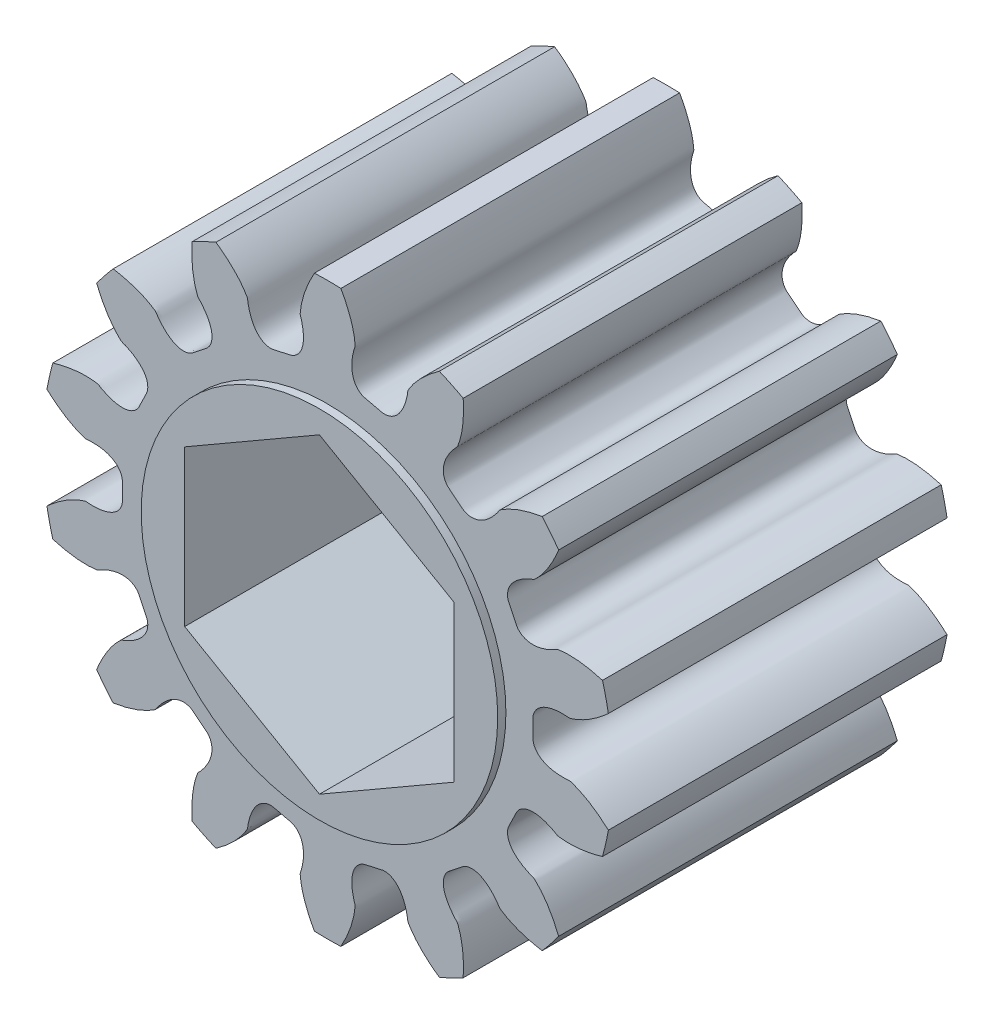
from build123d import *

# Parameters (mm, degrees)
BOSS_EXTRUDE1_DEPTH = 12.065
SKETCH2_R           = 6.35
BOSS_EXTRUDE2_DEPTH = 0.2921
BOSS_EXTRUDE3_START = 0.2921
SKETCH3_R           = 6.35
BOSS_EXTRUDE3_DEPTH = 0.2921
CUT_EXTRUDE1_DEPTH  = 20.058275239


with BuildPart() as part:
    # Sketch1 → Boss-Extrude1 (new body)
    with BuildSketch(Plane.XY.offset(6.0325)):
        with BuildLine():
            ThreePointArc((8.228776346, 5.959265042), (7.943407862, 6.334656387), (7.640928824, 6.69640252))
            add(Edge.make_bspline(
                [(4.82824311, 8.939444528), (4.833892588, 8.852687386), (4.83956114, 8.714236491), (4.839397518, 8.527056628), (4.834597301, 8.381215605), (4.825704165, 8.244427954), (4.813292608, 8.116797302), (4.797939964, 7.998399272), (4.780222678, 7.889283272), (4.760723014, 7.789466905), (4.740002099, 7.698954413), (4.718682579, 7.617677092), (4.697178715, 7.545684876), (4.676542333, 7.482543191), (4.650701206, 7.415927439), (4.621669261, 7.324730091), (4.540040809, 7.261231409), (4.481952223, 7.188233595), (4.43551344, 7.130936279), (4.39285588, 7.073433212), (4.35314075, 7.016307214), (4.316544651, 6.959436941), (4.282987183, 6.902864935), (4.252459951, 6.846571912), (4.224945594, 6.790531236), (4.200443436, 6.734690952), (4.178969629, 6.678974044), (4.160566483, 6.623273893), (4.145313008, 6.567451505), (4.133339922, 6.5113341), (4.12484958, 6.454717507), (4.120141721, 6.397375872), (4.119644468, 6.339084418), (4.123947256, 6.279663842), (4.133825193, 6.219056118), (4.150237388, 6.157442121), (4.174255479, 6.095387744), (4.206926479, 6.034019633), (4.248882322, 5.975011401), (4.295645816, 5.925851012), (4.399067692, 5.839116758), (4.564695196, 5.723946729), (4.713833258, 5.588099595), (4.821406436, 5.506570908), (4.879740128, 5.471919088), (4.946604954, 5.444145733), (5.01370442, 5.425949552), (5.079547492, 5.416342044), (5.143268754, 5.41405174), (5.204554963, 5.417907952), (5.263443202, 5.426935365), (5.320162519, 5.44039122), (5.375018882, 5.457740758), (5.4283267, 5.478616606), (5.480372862, 5.502776799), (5.531401448, 5.530069487), (5.581609996, 5.560405678), (5.631151593, 5.593739269), (5.680139601, 5.63005274), (5.7286527, 5.669347478), (5.776741391, 5.711635705), (5.82442778, 5.756940272), (5.871728798, 5.805273657), (5.918585081, 5.856704777), (5.965154226, 5.911088458), (6.010681377, 5.969112777), (6.068923056, 6.041988502), (6.112665655, 6.135700144), (6.195116279, 6.184297517), (6.254311643, 6.224314153), (6.311278208, 6.258483483), (6.376680368, 6.295467976), (6.451175858, 6.334338877), (6.534808176, 6.374681199), (6.627782855, 6.415903197), (6.730220622, 6.457456868), (6.842233881, 6.498770629), (6.963902735, 6.539271495), (7.095281925, 6.578379777), (7.23639826, 6.615512324), (7.418848724, 6.657323281), (7.555089737, 6.682605074), (7.640928824, 6.69640252)],
                knots=[0.010313213, 0.010313213, 0.010313213, 0.010313213, 0.046086444, 0.067310464, 0.087321683, 0.106120101, 0.123705718, 0.140078533, 0.155238548, 0.169185761, 0.181920174, 0.193441785, 0.203750595, 0.212846604, 0.220729812, 0.233281794, 0.251264484, 0.261666579, 0.271771633, 0.281588016, 0.291125391, 0.300394957, 0.309409753, 0.318185016, 0.32673863, 0.335091659, 0.343268986, 0.351300066, 0.359219801, 0.367069473, 0.374897695, 0.382761153, 0.390724829, 0.398861066, 0.407246569, 0.415956082, 0.425051594, 0.434566975, 0.44449066, 0.454752968, 0.462386324, 0.5, 0.537613676, 0.545247032, 0.55550934, 0.565433025, 0.574948406, 0.584043918, 0.592753431, 0.601138934, 0.609275171, 0.617238847, 0.625102305, 0.632930527, 0.640780199, 0.648699934, 0.656731014, 0.664908341, 0.67326137, 0.681814984, 0.690590247, 0.699605043, 0.708874609, 0.718411984, 0.728228367, 0.738333421, 0.748735516, 0.766718206, 0.779270188, 0.787153396, 0.796249405, 0.806558215, 0.818079826, 0.830814239, 0.844761452, 0.859921467, 0.876294282, 0.893879899, 0.912678317, 0.932689536, 0.953913556, 0.989686787, 0.989686787, 0.989686787, 0.989686787], degree=3))
            ThreePointArc((4.82824311, 8.939444528), (4.408258789, 9.153843698), (3.978778828, 9.348524966))
            add(Edge.make_bspline(
                [(0.471417111, 10.14905739), (0.514149629, 10.073343122), (0.579328409, 9.951062669), (0.66039529, 9.782348447), (0.719348491, 9.648867489), (0.770685991, 9.521767488), (0.814880429, 9.40139107), (0.852419155, 9.288056869), (0.883800089, 9.182059508), (0.909540197, 9.083667481), (0.930143197, 8.993128076), (0.946199881, 8.910649547), (0.958061821, 8.836456624), (0.966865234, 8.770614142), (0.972486674, 8.699383378), (0.985898842, 8.604620918), (0.939905194, 8.511993324), (0.919241751, 8.421020874), (0.902262226, 8.349248743), (0.888778739, 8.278931848), (0.877782684, 8.210231353), (0.869485825, 8.143114555), (0.863797265, 8.077584899), (0.860717807, 8.013621369), (0.860243365, 7.951192432), (0.862395875, 7.890250987), (0.867223304, 7.830734652), (0.874810032, 7.772565723), (0.885287552, 7.715653255), (0.898848604, 7.659898293), (0.91576409, 7.605204685), (0.936402058, 7.551498993), (0.961245763, 7.498764457), (0.990904063, 7.447095278), (1.026100482, 7.396775482), (1.06762067, 7.348384173), (1.116184607, 7.30289617), (1.172246787, 7.261780829), (1.235650407, 7.226820207), (1.299112753, 7.202818146), (1.429925226, 7.169546354), (1.629120853, 7.137644824), (1.822431467, 7.079959365), (1.954725523, 7.053178809), (2.022317225, 7.047268639), (2.094610758, 7.051257271), (2.162960315, 7.063976446), (2.226451415, 7.083888618), (2.284856014, 7.109472745), (2.338399833, 7.139538162), (2.387539455, 7.173222229), (2.432803517, 7.209955125), (2.47469971, 7.249387802), (2.513670703, 7.291325687), (2.55007996, 7.335675252), (2.584213274, 7.382405588), (2.616287232, 7.431522224), (2.646459766, 7.483050046), (2.674840612, 7.537022452), (2.701500055, 7.593474833), (2.726478295, 7.652440109), (2.749785332, 7.713948463), (2.771431007, 7.778018481), (2.791331932, 7.844686497), (2.809693087, 7.913890096), (2.825535825, 7.985921691), (2.846390172, 8.076850568), (2.845140934, 8.180261043), (2.89834077, 8.259819748), (2.934311383, 8.321557397), (2.970810967, 8.377059766), (3.013689307, 8.438758577), (3.063941972, 8.50610243), (3.12178821, 8.578736309), (3.187669946, 8.656216247), (3.261933723, 8.738100893), (3.344928813, 8.823924037), (3.436975996, 8.913204193), (3.538376109, 9.005442832), (3.649406325, 9.100126183), (3.795647418, 9.216958844), (3.90742697, 9.298849712), (3.978778828, 9.348524966)],
                knots=[0.010313213, 0.010313213, 0.010313213, 0.010313213, 0.046086444, 0.067310464, 0.087321683, 0.106120101, 0.123705718, 0.140078533, 0.155238548, 0.169185761, 0.181920174, 0.193441785, 0.203750595, 0.212846604, 0.220729812, 0.233281794, 0.251264484, 0.261666579, 0.271771633, 0.281588016, 0.291125391, 0.300394957, 0.309409753, 0.318185016, 0.32673863, 0.335091659, 0.343268986, 0.351300066, 0.359219801, 0.367069473, 0.374897695, 0.382761153, 0.390724829, 0.398861066, 0.407246569, 0.415956082, 0.425051594, 0.434566975, 0.44449066, 0.454752968, 0.462386324, 0.5, 0.537613676, 0.545247032, 0.55550934, 0.565433025, 0.574948406, 0.584043918, 0.592753431, 0.601138934, 0.609275171, 0.617238847, 0.625102305, 0.632930527, 0.640780199, 0.648699934, 0.656731014, 0.664908341, 0.67326137, 0.681814984, 0.690590247, 0.699605043, 0.708874609, 0.718411984, 0.728228367, 0.738333421, 0.748735516, 0.766718206, 0.779270188, 0.787153396, 0.796249405, 0.806558215, 0.818079826, 0.830814239, 0.844761452, 0.859921467, 0.876294282, 0.893879899, 0.912678317, 0.932689536, 0.953913556, 0.989686787, 0.989686787, 0.989686787, 0.989686787], degree=3))
            ThreePointArc((0.471417111, 10.14905739), (0, 10.16), (-0.471417111, 10.14905739))
            add(Edge.make_bspline(
                [(-3.978778828, 9.348524966), (-3.90742697, 9.298849712), (-3.795647418, 9.216958844), (-3.649406325, 9.100126183), (-3.538376109, 9.005442832), (-3.436975996, 8.913204193), (-3.344928813, 8.823924037), (-3.261933723, 8.738100893), (-3.187669946, 8.656216247), (-3.12178821, 8.578736309), (-3.063941972, 8.50610243), (-3.013689307, 8.438758577), (-2.970810967, 8.377059766), (-2.934311383, 8.321557397), (-2.89834077, 8.259819748), (-2.845140934, 8.180261043), (-2.846390172, 8.076850568), (-2.825535825, 7.985921691), (-2.809693087, 7.913890096), (-2.791331932, 7.844686497), (-2.771431007, 7.778018481), (-2.749785332, 7.713948463), (-2.726478295, 7.652440109), (-2.701500055, 7.593474833), (-2.674840612, 7.537022452), (-2.646459766, 7.483050046), (-2.616287232, 7.431522224), (-2.584213274, 7.382405588), (-2.55007996, 7.335675252), (-2.513670703, 7.291325687), (-2.47469971, 7.249387802), (-2.432803517, 7.209955125), (-2.387539455, 7.173222229), (-2.338399833, 7.139538162), (-2.284856014, 7.109472745), (-2.226451415, 7.083888618), (-2.162960315, 7.063976446), (-2.094610758, 7.051257271), (-2.022317225, 7.047268639), (-1.954725523, 7.053178809), (-1.822431467, 7.079959365), (-1.629120854, 7.137644824), (-1.429925226, 7.169546354), (-1.299112753, 7.202818146), (-1.235650407, 7.226820207), (-1.172246787, 7.261780829), (-1.116184607, 7.30289617), (-1.06762067, 7.348384173), (-1.026100482, 7.396775482), (-0.990904063, 7.447095278), (-0.961245763, 7.498764457), (-0.936402058, 7.551498993), (-0.91576409, 7.605204685), (-0.898848604, 7.659898293), (-0.885287552, 7.715653255), (-0.874810032, 7.772565723), (-0.867223304, 7.830734652), (-0.862395875, 7.890250987), (-0.860243365, 7.951192432), (-0.860717807, 8.013621369), (-0.863797265, 8.077584899), (-0.869485825, 8.143114555), (-0.877782684, 8.210231353), (-0.888778739, 8.278931848), (-0.902262226, 8.349248743), (-0.919241751, 8.421020874), (-0.939905194, 8.511993324), (-0.985898842, 8.604620918), (-0.972486674, 8.699383378), (-0.966865234, 8.770614142), (-0.958061821, 8.836456624), (-0.946199881, 8.910649547), (-0.930143197, 8.993128076), (-0.909540197, 9.083667481), (-0.883800089, 9.182059508), (-0.852419155, 9.288056869), (-0.814880429, 9.40139107), (-0.770685991, 9.521767488), (-0.719348492, 9.648867489), (-0.66039529, 9.782348447), (-0.579328409, 9.951062669), (-0.514149629, 10.073343122), (-0.471417111, 10.14905739)],
                knots=[0.010313213, 0.010313213, 0.010313213, 0.010313213, 0.046086444, 0.067310464, 0.087321683, 0.106120101, 0.123705718, 0.140078533, 0.155238548, 0.169185761, 0.181920174, 0.193441785, 0.203750595, 0.212846604, 0.220729812, 0.233281794, 0.251264484, 0.261666579, 0.271771633, 0.281588016, 0.291125391, 0.300394957, 0.309409753, 0.318185016, 0.32673863, 0.335091659, 0.343268986, 0.351300066, 0.359219801, 0.367069473, 0.374897695, 0.382761153, 0.390724829, 0.398861066, 0.407246569, 0.415956082, 0.425051594, 0.434566975, 0.44449066, 0.454752968, 0.462386324, 0.5, 0.537613676, 0.545247032, 0.55550934, 0.565433025, 0.574948406, 0.584043918, 0.592753431, 0.601138934, 0.609275171, 0.617238847, 0.625102305, 0.632930527, 0.640780199, 0.648699934, 0.656731014, 0.664908341, 0.67326137, 0.681814984, 0.690590247, 0.699605043, 0.708874609, 0.718411984, 0.728228367, 0.738333421, 0.748735516, 0.766718206, 0.779270188, 0.787153396, 0.796249405, 0.806558215, 0.818079826, 0.830814239, 0.844761452, 0.859921467, 0.876294282, 0.893879899, 0.912678317, 0.932689536, 0.953913556, 0.989686787, 0.989686787, 0.989686787, 0.989686787], degree=3))
            ThreePointArc((-3.978778828, 9.348524966), (-4.408258789, 9.153843698), (-4.82824311, 8.939444528))
            add(Edge.make_bspline(
                [(-7.640928824, 6.69640252), (-7.555089737, 6.682605074), (-7.418848724, 6.657323281), (-7.23639826, 6.615512324), (-7.095281925, 6.578379777), (-6.963902735, 6.539271495), (-6.842233881, 6.498770629), (-6.730220622, 6.457456868), (-6.627782855, 6.415903197), (-6.534808176, 6.374681199), (-6.451175858, 6.334338877), (-6.376680368, 6.295467976), (-6.311278208, 6.258483483), (-6.254311643, 6.224314153), (-6.195116279, 6.184297517), (-6.112665655, 6.135700144), (-6.068923056, 6.041988502), (-6.010681377, 5.969112777), (-5.965154226, 5.911088458), (-5.918585081, 5.856704777), (-5.871728798, 5.805273657), (-5.82442778, 5.756940272), (-5.776741391, 5.711635705), (-5.7286527, 5.669347478), (-5.680139601, 5.63005274), (-5.631151593, 5.59373927), (-5.581609996, 5.560405678), (-5.531401448, 5.530069487), (-5.480372862, 5.502776799), (-5.4283267, 5.478616606), (-5.375018882, 5.457740758), (-5.320162519, 5.44039122), (-5.263443202, 5.426935365), (-5.204554963, 5.417907952), (-5.143268754, 5.41405174), (-5.079547492, 5.416342044), (-5.01370442, 5.425949552), (-4.946604954, 5.444145733), (-4.879740128, 5.471919088), (-4.821406436, 5.506570908), (-4.713833258, 5.588099595), (-4.564695196, 5.723946729), (-4.399067692, 5.839116758), (-4.295645816, 5.925851012), (-4.248882322, 5.975011401), (-4.206926479, 6.034019633), (-4.174255479, 6.095387744), (-4.150237388, 6.157442121), (-4.133825193, 6.219056118), (-4.123947257, 6.279663842), (-4.119644468, 6.339084418), (-4.120141721, 6.397375872), (-4.12484958, 6.454717507), (-4.133339922, 6.5113341), (-4.145313008, 6.567451505), (-4.160566483, 6.623273893), (-4.178969629, 6.678974044), (-4.200443436, 6.734690952), (-4.224945594, 6.790531236), (-4.252459951, 6.846571912), (-4.282987183, 6.902864935), (-4.316544651, 6.959436941), (-4.35314075, 7.016307214), (-4.39285588, 7.073433212), (-4.43551344, 7.130936279), (-4.481952223, 7.188233595), (-4.540040809, 7.261231409), (-4.621669261, 7.324730091), (-4.650701206, 7.415927439), (-4.676542333, 7.482543191), (-4.697178715, 7.545684876), (-4.718682579, 7.617677092), (-4.740002099, 7.698954413), (-4.760723014, 7.789466905), (-4.780222678, 7.889283272), (-4.797939964, 7.998399272), (-4.813292608, 8.116797302), (-4.825704165, 8.244427954), (-4.834597301, 8.381215605), (-4.839397518, 8.527056628), (-4.83956114, 8.714236491), (-4.833892588, 8.852687386), (-4.82824311, 8.939444528)],
                knots=[0.010313213, 0.010313213, 0.010313213, 0.010313213, 0.046086444, 0.067310464, 0.087321683, 0.106120101, 0.123705718, 0.140078533, 0.155238548, 0.169185761, 0.181920174, 0.193441785, 0.203750595, 0.212846604, 0.220729812, 0.233281794, 0.251264484, 0.261666579, 0.271771633, 0.281588016, 0.291125391, 0.300394957, 0.309409753, 0.318185016, 0.32673863, 0.335091659, 0.343268986, 0.351300066, 0.359219801, 0.367069473, 0.374897695, 0.382761153, 0.390724829, 0.398861066, 0.407246569, 0.415956082, 0.425051594, 0.434566975, 0.44449066, 0.454752968, 0.462386324, 0.5, 0.537613676, 0.545247032, 0.55550934, 0.565433025, 0.574948406, 0.584043918, 0.592753431, 0.601138934, 0.609275171, 0.617238847, 0.625102305, 0.632930527, 0.640780199, 0.648699934, 0.656731014, 0.664908341, 0.67326137, 0.681814984, 0.690590247, 0.699605043, 0.708874609, 0.718411984, 0.728228367, 0.738333421, 0.748735516, 0.766718206, 0.779270188, 0.787153396, 0.796249405, 0.806558215, 0.818079826, 0.830814239, 0.844761452, 0.859921467, 0.876294282, 0.893879899, 0.912678317, 0.932689536, 0.953913556, 0.989686787, 0.989686787, 0.989686787, 0.989686787], degree=3))
            ThreePointArc((-7.640928824, 6.69640252), (-7.943407862, 6.334656387), (-8.228776346, 5.959265042))
            add(Edge.make_bspline(
                [(-9.789699156, 2.717975429), (-9.706374323, 2.742788544), (-9.572656053, 2.779123196), (-9.390132771, 2.820615114), (-9.246880138, 2.848387928), (-9.111543131, 2.870155878), (-8.984350614, 2.886455996), (-8.865504785, 2.897834316), (-8.755182084, 2.904841833), (-8.653529238, 2.908042297), (-8.560675246, 2.907981824), (-8.476691677, 2.905282734), (-8.401719397, 2.900337791), (-8.335568779, 2.894269154), (-8.264873031, 2.883899317), (-8.169501975, 2.875888583), (-8.089431298, 2.810436512), (-8.005337766, 2.77004787), (-7.939143412, 2.737523256), (-7.873589867, 2.708730847), (-7.809058689, 2.682723189), (-7.745470874, 2.659699456), (-7.682850007, 2.6395718), (-7.62117542, 2.622336326), (-7.56041728, 2.607982034), (-7.500524786, 2.596519828), (-7.441426445, 2.587982593), (-7.383027728, 2.582435302), (-7.325210706, 2.579985914), (-7.26783602, 2.580800315), (-7.210749644, 2.585121221), (-7.153798086, 2.593291112), (-7.096857471, 2.605777395), (-7.039884153, 2.623194626), (-6.98299404, 2.646311389), (-6.926576891, 2.6760225), (-6.871422875, 2.713246805), (-6.818863372, 2.758754365), (-6.770670653, 2.812788854), (-6.733148673, 2.869319105), (-6.671602561, 2.989448166), (-6.596175672, 3.176550785), (-6.49692085, 3.352178476), (-6.441373542, 3.475196409), (-6.420570983, 3.539778309), (-6.408372787, 3.611146847), (-6.405563859, 3.68061302), (-6.410848692, 3.746943141), (-6.422795126, 3.809576419), (-6.440192119, 3.868467967), (-6.462097062, 3.923870966), (-6.487836786, 3.976174002), (-6.516958024, 4.025794366), (-6.549172576, 4.073120332), (-6.584308384, 4.11848544), (-6.622271716, 4.162161438), (-6.663019767, 4.204360715), (-6.706541659, 4.245242779), (-6.752845532, 4.284922048), (-6.80195025, 4.32347492), (-6.853878962, 4.360947912), (-6.90865887, 4.397357489), (-6.966305902, 4.432717382), (-7.02687404, 4.466954379), (-7.090256819, 4.500254431), (-7.156957091, 4.531728495), (-7.240965662, 4.57229356), (-7.342061402, 4.594086638), (-7.407787327, 4.66365612), (-7.45997287, 4.712462794), (-7.505961757, 4.760397696), (-7.556572321, 4.815930264), (-7.611045453, 4.879908407), (-7.668986251, 4.952466877), (-7.729863539, 5.033937729), (-7.793169921, 5.124560606), (-7.858373155, 5.224572282), (-7.924932446, 5.334178353), (-7.992294822, 5.453561182), (-8.059897717, 5.582876666), (-8.141259434, 5.751448903), (-8.196223837, 5.878648341), (-8.228776346, 5.959265042)],
                knots=[0.010313213, 0.010313213, 0.010313213, 0.010313213, 0.046086444, 0.067310464, 0.087321683, 0.106120101, 0.123705718, 0.140078533, 0.155238548, 0.169185761, 0.181920174, 0.193441785, 0.203750595, 0.212846604, 0.220729812, 0.233281794, 0.251264484, 0.261666579, 0.271771633, 0.281588016, 0.291125391, 0.300394957, 0.309409753, 0.318185016, 0.32673863, 0.335091659, 0.343268986, 0.351300066, 0.359219801, 0.367069473, 0.374897695, 0.382761153, 0.390724829, 0.398861066, 0.407246569, 0.415956082, 0.425051594, 0.434566975, 0.44449066, 0.454752968, 0.462386324, 0.5, 0.537613676, 0.545247032, 0.55550934, 0.565433025, 0.574948406, 0.584043918, 0.592753431, 0.601138934, 0.609275171, 0.617238847, 0.625102305, 0.632930527, 0.640780199, 0.648699934, 0.656731014, 0.664908341, 0.67326137, 0.681814984, 0.690590247, 0.699605043, 0.708874609, 0.718411984, 0.728228367, 0.738333421, 0.748735516, 0.766718206, 0.779270188, 0.787153396, 0.796249405, 0.806558215, 0.818079826, 0.830814239, 0.844761452, 0.859921467, 0.876294282, 0.893879899, 0.912678317, 0.932689536, 0.953913556, 0.989686787, 0.989686787, 0.989686787, 0.989686787], degree=3))
            ThreePointArc((-9.789699156, 2.717975429), (-9.905267588, 2.260812689), (-9.999499508, 1.798780029))
            add(Edge.make_bspline(
                [(-9.999499508, -1.798780029), (-9.935192434, -1.740270896), (-9.830481451, -1.649516322), (-9.684036324, -1.532939511), (-9.567020335, -1.445762082), (-9.454530664, -1.36742931), (-9.347006522, -1.297556647), (-9.244866998, -1.235739863), (-9.148510127, -1.181559082), (-9.058312707, -1.134570046), (-8.974627912, -1.094336693), (-8.89779024, -1.060329384), (-8.828097019, -1.03225537), (-8.765864289, -1.009021346), (-8.697670317, -0.987690511), (-8.608268238, -0.953527983), (-8.507728461, -0.977756896), (-8.414438832, -0.977658989), (-8.340687878, -0.978242), (-8.269133617, -0.975740447), (-8.199708734, -0.971173509), (-8.13242847, -0.964327456), (-8.067275956, -0.955291671), (-8.00423088, -0.944060697), (-7.943261594, -0.930631498), (-7.884327057, -0.914972209), (-7.827377124, -0.897022183), (-7.772354818, -0.876681866), (-7.719200732, -0.853802823), (-7.667861282, -0.828175129), (-7.618303005, -0.799513277), (-7.570536207, -0.767442106), (-7.524652081, -0.731486746), (-7.480877949, -0.691074567), (-7.439651715, -0.645563388), (-7.401712789, -0.594316118), (-7.368171757, -0.536847748), (-7.340562272, -0.47304214), (-7.320586818, -0.40344871), (-7.31130824, -0.336236537), (-7.307979155, -0.201300135), (-7.32120266, 0), (-7.307979155, 0.201300135), (-7.31130824, 0.336236537), (-7.320586818, 0.40344871), (-7.340562272, 0.47304214), (-7.368171757, 0.536847748), (-7.401712789, 0.594316118), (-7.439651715, 0.645563388), (-7.480877949, 0.691074567), (-7.524652081, 0.731486746), (-7.570536207, 0.767442106), (-7.618303005, 0.799513277), (-7.667861282, 0.828175129), (-7.719200732, 0.853802823), (-7.772354818, 0.876681866), (-7.827377124, 0.897022183), (-7.884327057, 0.914972209), (-7.943261594, 0.930631498), (-8.00423088, 0.944060697), (-8.067275956, 0.955291671), (-8.13242847, 0.964327456), (-8.199708734, 0.971173509), (-8.269133617, 0.975740447), (-8.340687878, 0.978242), (-8.414438832, 0.977658989), (-8.507728461, 0.977756896), (-8.608268238, 0.953527983), (-8.697670317, 0.987690511), (-8.765864289, 1.009021346), (-8.828097019, 1.03225537), (-8.89779024, 1.060329384), (-8.974627912, 1.094336693), (-9.058312707, 1.134570046), (-9.148510127, 1.181559082), (-9.244866998, 1.235739863), (-9.347006522, 1.297556647), (-9.454530664, 1.36742931), (-9.567020335, 1.445762082), (-9.684036324, 1.532939511), (-9.830481451, 1.649516322), (-9.935192434, 1.740270896), (-9.999499508, 1.798780029)],
                knots=[0.010313213, 0.010313213, 0.010313213, 0.010313213, 0.046086444, 0.067310464, 0.087321683, 0.106120101, 0.123705718, 0.140078533, 0.155238548, 0.169185761, 0.181920174, 0.193441785, 0.203750595, 0.212846604, 0.220729812, 0.233281794, 0.251264484, 0.261666579, 0.271771633, 0.281588016, 0.291125391, 0.300394957, 0.309409753, 0.318185016, 0.32673863, 0.335091659, 0.343268986, 0.351300066, 0.359219801, 0.367069473, 0.374897695, 0.382761153, 0.390724829, 0.398861066, 0.407246569, 0.415956082, 0.425051594, 0.434566975, 0.44449066, 0.454752968, 0.462386324, 0.5, 0.537613676, 0.545247032, 0.55550934, 0.565433025, 0.574948406, 0.584043918, 0.592753431, 0.601138934, 0.609275171, 0.617238847, 0.625102305, 0.632930527, 0.640780199, 0.648699934, 0.656731014, 0.664908341, 0.67326137, 0.681814984, 0.690590247, 0.699605043, 0.708874609, 0.718411984, 0.728228367, 0.738333421, 0.748735516, 0.766718206, 0.779270188, 0.787153396, 0.796249405, 0.806558215, 0.818079826, 0.830814239, 0.844761452, 0.859921467, 0.876294282, 0.893879899, 0.912678317, 0.932689536, 0.953913556, 0.989686787, 0.989686787, 0.989686787, 0.989686787], degree=3))
            ThreePointArc((-9.999499508, -1.798780029), (-9.905267588, -2.260812689), (-9.789699156, -2.717975429))
            add(Edge.make_bspline(
                [(-8.228776346, -5.959265042), (-8.196223837, -5.878648341), (-8.141259434, -5.751448903), (-8.059897717, -5.582876666), (-7.992294822, -5.453561182), (-7.924932446, -5.334178353), (-7.858373155, -5.224572282), (-7.793169921, -5.124560606), (-7.729863539, -5.033937729), (-7.668986251, -4.952466877), (-7.611045453, -4.879908407), (-7.556572321, -4.815930264), (-7.505961757, -4.760397696), (-7.45997287, -4.712462794), (-7.407787327, -4.66365612), (-7.342061402, -4.594086638), (-7.240965662, -4.57229356), (-7.156957091, -4.531728495), (-7.090256819, -4.500254431), (-7.02687404, -4.466954379), (-6.966305902, -4.432717382), (-6.90865887, -4.397357489), (-6.853878962, -4.360947912), (-6.801950249, -4.32347492), (-6.752845532, -4.284922048), (-6.706541659, -4.245242779), (-6.663019767, -4.204360715), (-6.622271716, -4.162161438), (-6.584308383, -4.11848544), (-6.549172576, -4.073120332), (-6.516958024, -4.025794366), (-6.487836786, -3.976174002), (-6.462097062, -3.923870966), (-6.440192119, -3.868467967), (-6.422795126, -3.809576419), (-6.410848692, -3.746943141), (-6.405563859, -3.68061302), (-6.408372787, -3.611146847), (-6.420570983, -3.539778309), (-6.441373542, -3.475196409), (-6.49692085, -3.352178476), (-6.596175672, -3.176550785), (-6.671602561, -2.989448166), (-6.733148673, -2.869319105), (-6.770670653, -2.812788854), (-6.818863372, -2.758754365), (-6.871422875, -2.713246805), (-6.926576891, -2.6760225), (-6.98299404, -2.646311389), (-7.039884153, -2.623194626), (-7.096857471, -2.605777395), (-7.153798086, -2.593291112), (-7.210749644, -2.585121221), (-7.26783602, -2.580800315), (-7.325210706, -2.579985914), (-7.383027728, -2.582435302), (-7.441426445, -2.587982593), (-7.500524786, -2.596519828), (-7.56041728, -2.607982034), (-7.62117542, -2.622336326), (-7.682850007, -2.6395718), (-7.745470874, -2.659699456), (-7.809058689, -2.682723189), (-7.873589867, -2.708730847), (-7.939143412, -2.737523256), (-8.005337766, -2.77004787), (-8.089431298, -2.810436512), (-8.169501975, -2.875888583), (-8.264873031, -2.883899317), (-8.335568779, -2.894269154), (-8.401719397, -2.900337791), (-8.476691677, -2.905282734), (-8.560675246, -2.907981824), (-8.653529238, -2.908042297), (-8.755182084, -2.904841833), (-8.865504785, -2.897834316), (-8.984350614, -2.886455996), (-9.111543131, -2.870155878), (-9.246880138, -2.848387928), (-9.390132771, -2.820615114), (-9.572656053, -2.779123196), (-9.706374323, -2.742788544), (-9.789699156, -2.717975429)],
                knots=[0.010313213, 0.010313213, 0.010313213, 0.010313213, 0.046086444, 0.067310464, 0.087321683, 0.106120101, 0.123705718, 0.140078533, 0.155238548, 0.169185761, 0.181920174, 0.193441785, 0.203750595, 0.212846604, 0.220729812, 0.233281794, 0.251264484, 0.261666579, 0.271771633, 0.281588016, 0.291125391, 0.300394957, 0.309409753, 0.318185016, 0.32673863, 0.335091659, 0.343268986, 0.351300066, 0.359219801, 0.367069473, 0.374897695, 0.382761153, 0.390724829, 0.398861066, 0.407246569, 0.415956082, 0.425051594, 0.434566975, 0.44449066, 0.454752968, 0.462386324, 0.5, 0.537613676, 0.545247032, 0.55550934, 0.565433025, 0.574948406, 0.584043918, 0.592753431, 0.601138934, 0.609275171, 0.617238847, 0.625102305, 0.632930527, 0.640780199, 0.648699934, 0.656731014, 0.664908341, 0.67326137, 0.681814984, 0.690590247, 0.699605043, 0.708874609, 0.718411984, 0.728228367, 0.738333421, 0.748735516, 0.766718206, 0.779270188, 0.787153396, 0.796249405, 0.806558215, 0.818079826, 0.830814239, 0.844761452, 0.859921467, 0.876294282, 0.893879899, 0.912678317, 0.932689536, 0.953913556, 0.989686787, 0.989686787, 0.989686787, 0.989686787], degree=3))
            ThreePointArc((-8.228776346, -5.959265042), (-7.943407862, -6.334656387), (-7.640928824, -6.69640252))
            add(Edge.make_bspline(
                [(-4.82824311, -8.939444528), (-4.833892588, -8.852687386), (-4.83956114, -8.714236491), (-4.839397518, -8.527056628), (-4.834597301, -8.381215605), (-4.825704165, -8.244427954), (-4.813292608, -8.116797302), (-4.797939964, -7.998399272), (-4.780222678, -7.889283272), (-4.760723014, -7.789466905), (-4.740002099, -7.698954413), (-4.718682579, -7.617677092), (-4.697178715, -7.545684876), (-4.676542333, -7.482543191), (-4.650701206, -7.415927439), (-4.621669261, -7.324730091), (-4.540040809, -7.261231409), (-4.481952223, -7.188233595), (-4.43551344, -7.130936279), (-4.39285588, -7.073433212), (-4.35314075, -7.016307214), (-4.316544651, -6.959436941), (-4.282987183, -6.902864935), (-4.252459951, -6.846571912), (-4.224945594, -6.790531236), (-4.200443436, -6.734690952), (-4.178969629, -6.678974044), (-4.160566483, -6.623273893), (-4.145313008, -6.567451505), (-4.133339922, -6.5113341), (-4.12484958, -6.454717507), (-4.120141721, -6.397375872), (-4.119644468, -6.339084418), (-4.123947257, -6.279663842), (-4.133825193, -6.219056118), (-4.150237388, -6.157442121), (-4.174255479, -6.095387744), (-4.206926479, -6.034019633), (-4.248882322, -5.975011401), (-4.295645816, -5.925851012), (-4.399067692, -5.839116758), (-4.564695196, -5.723946729), (-4.713833258, -5.588099595), (-4.821406436, -5.506570908), (-4.879740128, -5.471919088), (-4.946604954, -5.444145733), (-5.01370442, -5.425949552), (-5.079547492, -5.416342044), (-5.143268754, -5.41405174), (-5.204554963, -5.417907952), (-5.263443202, -5.426935365), (-5.320162519, -5.44039122), (-5.375018882, -5.457740758), (-5.4283267, -5.478616606), (-5.480372862, -5.502776799), (-5.531401448, -5.530069487), (-5.581609996, -5.560405678), (-5.631151593, -5.59373927), (-5.680139601, -5.63005274), (-5.7286527, -5.669347478), (-5.776741391, -5.711635705), (-5.82442778, -5.756940272), (-5.871728798, -5.805273657), (-5.918585081, -5.856704777), (-5.965154226, -5.911088458), (-6.010681377, -5.969112777), (-6.068923056, -6.041988502), (-6.112665655, -6.135700144), (-6.195116279, -6.184297517), (-6.254311643, -6.224314153), (-6.311278208, -6.258483483), (-6.376680368, -6.295467976), (-6.451175858, -6.334338877), (-6.534808176, -6.374681199), (-6.627782855, -6.415903197), (-6.730220622, -6.457456868), (-6.842233881, -6.498770629), (-6.963902735, -6.539271495), (-7.095281925, -6.578379777), (-7.23639826, -6.615512324), (-7.418848724, -6.657323281), (-7.555089737, -6.682605074), (-7.640928824, -6.69640252)],
                knots=[0.010313213, 0.010313213, 0.010313213, 0.010313213, 0.046086444, 0.067310464, 0.087321683, 0.106120101, 0.123705718, 0.140078533, 0.155238548, 0.169185761, 0.181920174, 0.193441785, 0.203750595, 0.212846604, 0.220729812, 0.233281794, 0.251264484, 0.261666579, 0.271771633, 0.281588016, 0.291125391, 0.300394957, 0.309409753, 0.318185016, 0.32673863, 0.335091659, 0.343268986, 0.351300066, 0.359219801, 0.367069473, 0.374897695, 0.382761153, 0.390724829, 0.398861066, 0.407246569, 0.415956082, 0.425051594, 0.434566975, 0.44449066, 0.454752968, 0.462386324, 0.5, 0.537613676, 0.545247032, 0.55550934, 0.565433025, 0.574948406, 0.584043918, 0.592753431, 0.601138934, 0.609275171, 0.617238847, 0.625102305, 0.632930527, 0.640780199, 0.648699934, 0.656731014, 0.664908341, 0.67326137, 0.681814984, 0.690590247, 0.699605043, 0.708874609, 0.718411984, 0.728228367, 0.738333421, 0.748735516, 0.766718206, 0.779270188, 0.787153396, 0.796249405, 0.806558215, 0.818079826, 0.830814239, 0.844761452, 0.859921467, 0.876294282, 0.893879899, 0.912678317, 0.932689536, 0.953913556, 0.989686787, 0.989686787, 0.989686787, 0.989686787], degree=3))
            ThreePointArc((-4.82824311, -8.939444528), (-4.408258789, -9.153843698), (-3.978778828, -9.348524966))
            add(Edge.make_bspline(
                [(-0.471417111, -10.14905739), (-0.514149629, -10.073343122), (-0.579328409, -9.951062669), (-0.66039529, -9.782348447), (-0.719348492, -9.648867489), (-0.770685991, -9.521767488), (-0.814880429, -9.40139107), (-0.852419155, -9.288056869), (-0.883800089, -9.182059508), (-0.909540197, -9.083667481), (-0.930143197, -8.993128076), (-0.946199881, -8.910649547), (-0.958061821, -8.836456624), (-0.966865234, -8.770614142), (-0.972486674, -8.699383378), (-0.985898842, -8.604620918), (-0.939905194, -8.511993324), (-0.919241751, -8.421020874), (-0.902262226, -8.349248743), (-0.888778739, -8.278931848), (-0.877782684, -8.210231353), (-0.869485825, -8.143114555), (-0.863797265, -8.077584899), (-0.860717807, -8.013621369), (-0.860243365, -7.951192432), (-0.862395875, -7.890250987), (-0.867223304, -7.830734652), (-0.874810032, -7.772565723), (-0.885287552, -7.715653255), (-0.898848604, -7.659898293), (-0.91576409, -7.605204685), (-0.936402058, -7.551498993), (-0.961245763, -7.498764457), (-0.990904063, -7.447095278), (-1.026100482, -7.396775482), (-1.06762067, -7.348384173), (-1.116184607, -7.30289617), (-1.172246787, -7.261780829), (-1.235650407, -7.226820207), (-1.299112753, -7.202818146), (-1.429925226, -7.169546354), (-1.629120854, -7.137644824), (-1.822431467, -7.079959365), (-1.954725523, -7.053178809), (-2.022317225, -7.047268639), (-2.094610758, -7.051257271), (-2.162960315, -7.063976446), (-2.226451415, -7.083888618), (-2.284856014, -7.109472746), (-2.338399833, -7.139538162), (-2.387539455, -7.173222229), (-2.432803517, -7.209955125), (-2.47469971, -7.249387802), (-2.513670703, -7.291325687), (-2.55007996, -7.335675252), (-2.584213274, -7.382405588), (-2.616287232, -7.431522224), (-2.646459766, -7.483050046), (-2.674840612, -7.537022452), (-2.701500055, -7.593474833), (-2.726478295, -7.652440109), (-2.749785332, -7.713948463), (-2.771431007, -7.778018481), (-2.791331932, -7.844686497), (-2.809693087, -7.913890096), (-2.825535825, -7.985921691), (-2.846390172, -8.076850568), (-2.845140934, -8.180261043), (-2.89834077, -8.259819748), (-2.934311383, -8.321557397), (-2.970810967, -8.377059766), (-3.013689307, -8.438758577), (-3.063941972, -8.50610243), (-3.12178821, -8.578736309), (-3.187669946, -8.656216247), (-3.261933723, -8.738100893), (-3.344928813, -8.823924037), (-3.436975996, -8.913204193), (-3.538376109, -9.005442832), (-3.649406325, -9.100126183), (-3.795647418, -9.216958844), (-3.90742697, -9.298849712), (-3.978778828, -9.348524966)],
                knots=[0.010313213, 0.010313213, 0.010313213, 0.010313213, 0.046086444, 0.067310464, 0.087321683, 0.106120101, 0.123705718, 0.140078533, 0.155238548, 0.169185761, 0.181920174, 0.193441785, 0.203750595, 0.212846604, 0.220729812, 0.233281794, 0.251264484, 0.261666579, 0.271771633, 0.281588016, 0.291125391, 0.300394957, 0.309409753, 0.318185016, 0.32673863, 0.335091659, 0.343268986, 0.351300066, 0.359219801, 0.367069473, 0.374897695, 0.382761153, 0.390724829, 0.398861066, 0.407246569, 0.415956082, 0.425051594, 0.434566975, 0.44449066, 0.454752968, 0.462386324, 0.5, 0.537613676, 0.545247032, 0.55550934, 0.565433025, 0.574948406, 0.584043918, 0.592753431, 0.601138934, 0.609275171, 0.617238847, 0.625102305, 0.632930527, 0.640780199, 0.648699934, 0.656731014, 0.664908341, 0.67326137, 0.681814984, 0.690590247, 0.699605043, 0.708874609, 0.718411984, 0.728228367, 0.738333421, 0.748735516, 0.766718206, 0.779270188, 0.787153396, 0.796249405, 0.806558215, 0.818079826, 0.830814239, 0.844761452, 0.859921467, 0.876294282, 0.893879899, 0.912678317, 0.932689536, 0.953913556, 0.989686787, 0.989686787, 0.989686787, 0.989686787], degree=3))
            ThreePointArc((-0.471417111, -10.14905739), (0, -10.16), (0.471417111, -10.14905739))
            add(Edge.make_bspline(
                [(3.978778828, -9.348524966), (3.90742697, -9.298849712), (3.795647418, -9.216958844), (3.649406325, -9.100126183), (3.538376109, -9.005442832), (3.436975996, -8.913204193), (3.344928813, -8.823924037), (3.261933723, -8.738100893), (3.187669946, -8.656216247), (3.12178821, -8.578736309), (3.063941972, -8.50610243), (3.013689307, -8.438758577), (2.970810967, -8.377059766), (2.934311383, -8.321557397), (2.89834077, -8.259819748), (2.845140934, -8.180261043), (2.846390172, -8.076850568), (2.825535825, -7.985921691), (2.809693087, -7.913890096), (2.791331932, -7.844686497), (2.771431007, -7.778018481), (2.749785332, -7.713948463), (2.726478295, -7.652440109), (2.701500055, -7.593474833), (2.674840612, -7.537022452), (2.646459766, -7.483050046), (2.616287232, -7.431522224), (2.584213274, -7.382405588), (2.55007996, -7.335675252), (2.513670703, -7.291325687), (2.47469971, -7.249387802), (2.432803517, -7.209955124), (2.387539455, -7.173222229), (2.338399833, -7.139538162), (2.284856014, -7.109472745), (2.226451415, -7.083888618), (2.162960315, -7.063976446), (2.094610758, -7.051257271), (2.022317225, -7.047268639), (1.954725523, -7.053178809), (1.822431467, -7.079959365), (1.629120854, -7.137644824), (1.429925226, -7.169546354), (1.299112753, -7.202818146), (1.235650407, -7.226820207), (1.172246787, -7.261780829), (1.116184607, -7.30289617), (1.06762067, -7.348384173), (1.026100482, -7.396775482), (0.990904063, -7.447095278), (0.961245763, -7.498764457), (0.936402058, -7.551498993), (0.91576409, -7.605204685), (0.898848604, -7.659898293), (0.885287552, -7.715653255), (0.874810032, -7.772565723), (0.867223304, -7.830734652), (0.862395875, -7.890250987), (0.860243365, -7.951192432), (0.860717807, -8.013621369), (0.863797265, -8.077584899), (0.869485825, -8.143114555), (0.877782684, -8.210231353), (0.888778739, -8.278931848), (0.902262226, -8.349248743), (0.919241751, -8.421020874), (0.939905194, -8.511993324), (0.985898842, -8.604620918), (0.972486674, -8.699383378), (0.966865234, -8.770614142), (0.958061821, -8.836456624), (0.946199881, -8.910649547), (0.930143197, -8.993128076), (0.909540197, -9.083667481), (0.883800089, -9.182059508), (0.852419155, -9.288056869), (0.814880429, -9.40139107), (0.770685991, -9.521767488), (0.719348492, -9.648867489), (0.66039529, -9.782348447), (0.579328409, -9.951062669), (0.514149629, -10.073343122), (0.471417111, -10.14905739)],
                knots=[0.010313213, 0.010313213, 0.010313213, 0.010313213, 0.046086444, 0.067310464, 0.087321683, 0.106120101, 0.123705718, 0.140078533, 0.155238548, 0.169185761, 0.181920174, 0.193441785, 0.203750595, 0.212846604, 0.220729812, 0.233281794, 0.251264484, 0.261666579, 0.271771633, 0.281588016, 0.291125391, 0.300394957, 0.309409753, 0.318185016, 0.32673863, 0.335091659, 0.343268986, 0.351300066, 0.359219801, 0.367069473, 0.374897695, 0.382761153, 0.390724829, 0.398861066, 0.407246569, 0.415956082, 0.425051594, 0.434566975, 0.44449066, 0.454752968, 0.462386324, 0.5, 0.537613676, 0.545247032, 0.55550934, 0.565433025, 0.574948406, 0.584043918, 0.592753431, 0.601138934, 0.609275171, 0.617238847, 0.625102305, 0.632930527, 0.640780199, 0.648699934, 0.656731014, 0.664908341, 0.67326137, 0.681814984, 0.690590247, 0.699605043, 0.708874609, 0.718411984, 0.728228367, 0.738333421, 0.748735516, 0.766718206, 0.779270188, 0.787153396, 0.796249405, 0.806558215, 0.818079826, 0.830814239, 0.844761452, 0.859921467, 0.876294282, 0.893879899, 0.912678317, 0.932689536, 0.953913556, 0.989686787, 0.989686787, 0.989686787, 0.989686787], degree=3))
            ThreePointArc((3.978778828, -9.348524966), (4.408258789, -9.153843698), (4.82824311, -8.939444528))
            add(Edge.make_bspline(
                [(7.640928824, -6.69640252), (7.555089737, -6.682605074), (7.418848724, -6.657323281), (7.23639826, -6.615512324), (7.095281925, -6.578379777), (6.963902735, -6.539271495), (6.842233881, -6.498770629), (6.730220622, -6.457456868), (6.627782855, -6.415903197), (6.534808176, -6.374681199), (6.451175858, -6.334338877), (6.376680368, -6.295467976), (6.311278208, -6.258483483), (6.254311643, -6.224314153), (6.195116279, -6.184297517), (6.112665655, -6.135700144), (6.068923056, -6.041988502), (6.010681377, -5.969112777), (5.965154226, -5.911088458), (5.918585081, -5.856704777), (5.871728798, -5.805273657), (5.82442778, -5.756940272), (5.776741391, -5.711635705), (5.7286527, -5.669347478), (5.680139601, -5.63005274), (5.631151593, -5.593739269), (5.581609996, -5.560405678), (5.531401448, -5.530069487), (5.480372862, -5.502776799), (5.4283267, -5.478616606), (5.375018882, -5.457740758), (5.320162519, -5.44039122), (5.263443202, -5.426935365), (5.204554963, -5.417907952), (5.143268754, -5.41405174), (5.079547492, -5.416342044), (5.01370442, -5.425949552), (4.946604954, -5.444145733), (4.879740128, -5.471919088), (4.821406436, -5.506570908), (4.713833258, -5.588099595), (4.564695196, -5.723946729), (4.399067692, -5.839116758), (4.295645816, -5.925851012), (4.248882322, -5.975011401), (4.206926479, -6.034019633), (4.174255479, -6.095387744), (4.150237388, -6.157442121), (4.133825193, -6.219056118), (4.123947257, -6.279663842), (4.119644468, -6.339084418), (4.120141721, -6.397375872), (4.12484958, -6.454717507), (4.133339922, -6.5113341), (4.145313008, -6.567451505), (4.160566483, -6.623273893), (4.178969629, -6.678974044), (4.200443436, -6.734690952), (4.224945594, -6.790531236), (4.252459951, -6.846571912), (4.282987183, -6.902864935), (4.316544651, -6.959436941), (4.35314075, -7.016307214), (4.39285588, -7.073433212), (4.43551344, -7.130936279), (4.481952223, -7.188233595), (4.540040809, -7.261231409), (4.621669261, -7.324730091), (4.650701206, -7.415927439), (4.676542333, -7.482543191), (4.697178715, -7.545684876), (4.718682579, -7.617677092), (4.740002099, -7.698954413), (4.760723014, -7.789466905), (4.780222678, -7.889283272), (4.797939964, -7.998399272), (4.813292608, -8.116797302), (4.825704165, -8.244427954), (4.834597301, -8.381215605), (4.839397518, -8.527056628), (4.83956114, -8.714236491), (4.833892588, -8.852687386), (4.82824311, -8.939444528)],
                knots=[0.010313213, 0.010313213, 0.010313213, 0.010313213, 0.046086444, 0.067310464, 0.087321683, 0.106120101, 0.123705718, 0.140078533, 0.155238548, 0.169185761, 0.181920174, 0.193441785, 0.203750595, 0.212846604, 0.220729812, 0.233281794, 0.251264484, 0.261666579, 0.271771633, 0.281588016, 0.291125391, 0.300394957, 0.309409753, 0.318185016, 0.32673863, 0.335091659, 0.343268986, 0.351300066, 0.359219801, 0.367069473, 0.374897695, 0.382761153, 0.390724829, 0.398861066, 0.407246569, 0.415956082, 0.425051594, 0.434566975, 0.44449066, 0.454752968, 0.462386324, 0.5, 0.537613676, 0.545247032, 0.55550934, 0.565433025, 0.574948406, 0.584043918, 0.592753431, 0.601138934, 0.609275171, 0.617238847, 0.625102305, 0.632930527, 0.640780199, 0.648699934, 0.656731014, 0.664908341, 0.67326137, 0.681814984, 0.690590247, 0.699605043, 0.708874609, 0.718411984, 0.728228367, 0.738333421, 0.748735516, 0.766718206, 0.779270188, 0.787153396, 0.796249405, 0.806558215, 0.818079826, 0.830814239, 0.844761452, 0.859921467, 0.876294282, 0.893879899, 0.912678317, 0.932689536, 0.953913556, 0.989686787, 0.989686787, 0.989686787, 0.989686787], degree=3))
            ThreePointArc((7.640928824, -6.69640252), (7.943407862, -6.334656387), (8.228776346, -5.959265042))
            add(Edge.make_bspline(
                [(9.789699156, -2.717975429), (9.706374323, -2.742788544), (9.572656053, -2.779123196), (9.390132771, -2.820615114), (9.246880138, -2.848387928), (9.111543131, -2.870155878), (8.984350614, -2.886455996), (8.865504785, -2.897834316), (8.755182084, -2.904841833), (8.653529238, -2.908042297), (8.560675246, -2.907981824), (8.476691677, -2.905282734), (8.401719397, -2.900337791), (8.335568779, -2.894269154), (8.264873031, -2.883899317), (8.169501975, -2.875888583), (8.089431298, -2.810436512), (8.005337766, -2.77004787), (7.939143412, -2.737523256), (7.873589867, -2.708730847), (7.809058689, -2.682723189), (7.745470874, -2.659699456), (7.682850007, -2.6395718), (7.62117542, -2.622336326), (7.56041728, -2.607982034), (7.500524786, -2.596519828), (7.441426445, -2.587982593), (7.383027728, -2.582435302), (7.325210706, -2.579985914), (7.26783602, -2.580800315), (7.210749644, -2.585121221), (7.153798086, -2.593291112), (7.096857471, -2.605777395), (7.039884153, -2.623194626), (6.98299404, -2.646311389), (6.926576891, -2.6760225), (6.871422875, -2.713246805), (6.818863372, -2.758754365), (6.770670653, -2.812788854), (6.733148673, -2.869319105), (6.671602561, -2.989448166), (6.596175672, -3.176550785), (6.49692085, -3.352178476), (6.441373542, -3.475196409), (6.420570983, -3.539778309), (6.408372787, -3.611146847), (6.405563859, -3.68061302), (6.410848692, -3.746943141), (6.422795126, -3.809576419), (6.440192119, -3.868467967), (6.462097062, -3.923870966), (6.487836786, -3.976174002), (6.516958024, -4.025794366), (6.549172576, -4.073120332), (6.584308383, -4.11848544), (6.622271716, -4.162161438), (6.663019767, -4.204360715), (6.706541659, -4.245242779), (6.752845532, -4.284922048), (6.801950249, -4.32347492), (6.853878962, -4.360947912), (6.90865887, -4.397357489), (6.966305902, -4.432717382), (7.02687404, -4.466954379), (7.090256819, -4.500254431), (7.156957091, -4.531728495), (7.240965662, -4.57229356), (7.342061402, -4.594086638), (7.407787327, -4.66365612), (7.45997287, -4.712462794), (7.505961757, -4.760397696), (7.556572321, -4.815930264), (7.611045453, -4.879908407), (7.668986251, -4.952466877), (7.729863539, -5.033937729), (7.793169921, -5.124560606), (7.858373155, -5.224572282), (7.924932446, -5.334178353), (7.992294822, -5.453561182), (8.059897717, -5.582876666), (8.141259434, -5.751448903), (8.196223837, -5.878648341), (8.228776346, -5.959265042)],
                knots=[0.010313213, 0.010313213, 0.010313213, 0.010313213, 0.046086444, 0.067310464, 0.087321683, 0.106120101, 0.123705718, 0.140078533, 0.155238548, 0.169185761, 0.181920174, 0.193441785, 0.203750595, 0.212846604, 0.220729812, 0.233281794, 0.251264484, 0.261666579, 0.271771633, 0.281588016, 0.291125391, 0.300394957, 0.309409753, 0.318185016, 0.32673863, 0.335091659, 0.343268986, 0.351300066, 0.359219801, 0.367069473, 0.374897695, 0.382761153, 0.390724829, 0.398861066, 0.407246569, 0.415956082, 0.425051594, 0.434566975, 0.44449066, 0.454752968, 0.462386324, 0.5, 0.537613676, 0.545247032, 0.55550934, 0.565433025, 0.574948406, 0.584043918, 0.592753431, 0.601138934, 0.609275171, 0.617238847, 0.625102305, 0.632930527, 0.640780199, 0.648699934, 0.656731014, 0.664908341, 0.67326137, 0.681814984, 0.690590247, 0.699605043, 0.708874609, 0.718411984, 0.728228367, 0.738333421, 0.748735516, 0.766718206, 0.779270188, 0.787153396, 0.796249405, 0.806558215, 0.818079826, 0.830814239, 0.844761452, 0.859921467, 0.876294282, 0.893879899, 0.912678317, 0.932689536, 0.953913556, 0.989686787, 0.989686787, 0.989686787, 0.989686787], degree=3))
            ThreePointArc((9.789699156, -2.717975429), (9.905267588, -2.260812689), (9.999499508, -1.798780029))
            add(Edge.make_bspline(
                [(9.999499508, 1.798780029), (9.935192434, 1.740270896), (9.830481451, 1.649516323), (9.684036324, 1.532939511), (9.567020334, 1.445762082), (9.454530664, 1.36742931), (9.347006522, 1.297556647), (9.244866998, 1.235739863), (9.148510127, 1.181559082), (9.058312707, 1.134570046), (8.974627912, 1.094336693), (8.89779024, 1.060329384), (8.828097019, 1.03225537), (8.765864289, 1.009021346), (8.697670317, 0.987690511), (8.608268238, 0.953527983), (8.507728461, 0.977756896), (8.414438832, 0.977658989), (8.340687878, 0.978242), (8.269133617, 0.975740447), (8.199708734, 0.971173509), (8.13242847, 0.964327456), (8.067275956, 0.955291671), (8.00423088, 0.944060697), (7.943261594, 0.930631498), (7.884327057, 0.914972209), (7.827377124, 0.897022183), (7.772354818, 0.876681866), (7.719200732, 0.853802823), (7.667861281, 0.828175129), (7.618303005, 0.799513277), (7.570536207, 0.767442106), (7.524652081, 0.731486746), (7.480877948, 0.691074567), (7.439651715, 0.645563388), (7.401712789, 0.594316118), (7.368171757, 0.536847748), (7.340562272, 0.47304214), (7.320586818, 0.40344871), (7.31130824, 0.336236537), (7.307979155, 0.201300135), (7.32120266, 0), (7.307979155, -0.201300135), (7.31130824, -0.336236537), (7.320586818, -0.40344871), (7.340562272, -0.47304214), (7.368171757, -0.536847748), (7.401712789, -0.594316118), (7.439651715, -0.645563388), (7.480877948, -0.691074567), (7.524652081, -0.731486746), (7.570536207, -0.767442106), (7.618303005, -0.799513277), (7.667861281, -0.828175129), (7.719200732, -0.853802823), (7.772354818, -0.876681866), (7.827377124, -0.897022183), (7.884327057, -0.914972209), (7.943261594, -0.930631498), (8.00423088, -0.944060697), (8.067275956, -0.955291671), (8.13242847, -0.964327456), (8.199708734, -0.971173509), (8.269133617, -0.975740447), (8.340687878, -0.978242), (8.414438832, -0.977658989), (8.507728461, -0.977756896), (8.608268238, -0.953527983), (8.697670317, -0.987690511), (8.765864289, -1.009021346), (8.828097019, -1.03225537), (8.89779024, -1.060329384), (8.974627912, -1.094336693), (9.058312707, -1.134570046), (9.148510127, -1.181559082), (9.244866998, -1.235739862), (9.347006522, -1.297556647), (9.454530664, -1.36742931), (9.567020334, -1.445762082), (9.684036324, -1.532939511), (9.830481451, -1.649516322), (9.935192434, -1.740270896), (9.999499508, -1.798780029)],
                knots=[0.010313213, 0.010313213, 0.010313213, 0.010313213, 0.046086444, 0.067310464, 0.087321683, 0.106120101, 0.123705718, 0.140078533, 0.155238548, 0.169185761, 0.181920174, 0.193441785, 0.203750595, 0.212846604, 0.220729812, 0.233281794, 0.251264484, 0.261666579, 0.271771633, 0.281588016, 0.291125391, 0.300394957, 0.309409753, 0.318185016, 0.32673863, 0.335091659, 0.343268986, 0.351300066, 0.359219801, 0.367069473, 0.374897695, 0.382761153, 0.390724829, 0.398861066, 0.407246569, 0.415956082, 0.425051594, 0.434566975, 0.44449066, 0.454752968, 0.462386324, 0.5, 0.537613676, 0.545247032, 0.55550934, 0.565433025, 0.574948406, 0.584043918, 0.592753431, 0.601138934, 0.609275171, 0.617238847, 0.625102305, 0.632930527, 0.640780199, 0.648699934, 0.656731014, 0.664908341, 0.67326137, 0.681814984, 0.690590247, 0.699605043, 0.708874609, 0.718411984, 0.728228367, 0.738333421, 0.748735516, 0.766718206, 0.779270188, 0.787153396, 0.796249405, 0.806558215, 0.818079826, 0.830814239, 0.844761452, 0.859921467, 0.876294282, 0.893879899, 0.912678317, 0.932689536, 0.953913556, 0.989686787, 0.989686787, 0.989686787, 0.989686787], degree=3))
            ThreePointArc((9.999499508, 1.798780029), (9.905267588, 2.260812689), (9.789699156, 2.717975429))
            add(Edge.make_bspline(
                [(8.228776346, 5.959265042), (8.196223837, 5.878648341), (8.141259434, 5.751448903), (8.059897717, 5.582876666), (7.992294822, 5.453561182), (7.924932446, 5.334178353), (7.858373155, 5.224572282), (7.793169921, 5.124560606), (7.729863539, 5.033937729), (7.668986251, 4.952466877), (7.611045453, 4.879908407), (7.556572321, 4.815930264), (7.505961757, 4.760397696), (7.45997287, 4.712462794), (7.407787327, 4.66365612), (7.342061402, 4.594086638), (7.240965662, 4.57229356), (7.156957091, 4.531728495), (7.090256819, 4.500254431), (7.02687404, 4.466954379), (6.966305902, 4.432717382), (6.90865887, 4.397357489), (6.853878962, 4.360947912), (6.801950249, 4.32347492), (6.752845532, 4.284922048), (6.706541659, 4.245242779), (6.663019767, 4.204360715), (6.622271716, 4.162161438), (6.584308383, 4.11848544), (6.549172576, 4.073120332), (6.516958024, 4.025794366), (6.487836786, 3.976174002), (6.462097062, 3.923870966), (6.440192119, 3.868467967), (6.422795126, 3.809576419), (6.410848692, 3.746943141), (6.405563859, 3.68061302), (6.408372787, 3.611146847), (6.420570983, 3.539778309), (6.441373542, 3.475196409), (6.49692085, 3.352178476), (6.596175672, 3.176550785), (6.671602561, 2.989448166), (6.733148673, 2.869319105), (6.770670653, 2.812788854), (6.818863372, 2.758754365), (6.871422875, 2.713246805), (6.926576891, 2.6760225), (6.98299404, 2.646311389), (7.039884153, 2.623194626), (7.096857471, 2.605777395), (7.153798086, 2.593291112), (7.210749644, 2.585121221), (7.26783602, 2.580800315), (7.325210706, 2.579985914), (7.383027728, 2.582435302), (7.441426445, 2.587982593), (7.500524786, 2.596519828), (7.56041728, 2.607982034), (7.62117542, 2.622336326), (7.682850007, 2.6395718), (7.745470874, 2.659699456), (7.809058689, 2.682723189), (7.873589867, 2.708730847), (7.939143412, 2.737523256), (8.005337766, 2.77004787), (8.089431298, 2.810436512), (8.169501975, 2.875888583), (8.264873031, 2.883899317), (8.335568779, 2.894269154), (8.401719397, 2.900337791), (8.476691677, 2.905282734), (8.560675246, 2.907981824), (8.653529238, 2.908042297), (8.755182084, 2.904841833), (8.865504785, 2.897834316), (8.984350614, 2.886455996), (9.111543131, 2.870155878), (9.246880138, 2.848387928), (9.390132771, 2.820615114), (9.572656053, 2.779123196), (9.706374323, 2.742788544), (9.789699156, 2.717975429)],
                knots=[0.010313213, 0.010313213, 0.010313213, 0.010313213, 0.046086444, 0.067310464, 0.087321683, 0.106120101, 0.123705718, 0.140078533, 0.155238548, 0.169185761, 0.181920174, 0.193441785, 0.203750595, 0.212846604, 0.220729812, 0.233281794, 0.251264484, 0.261666579, 0.271771633, 0.281588016, 0.291125391, 0.300394957, 0.309409753, 0.318185016, 0.32673863, 0.335091659, 0.343268986, 0.351300066, 0.359219801, 0.367069473, 0.374897695, 0.382761153, 0.390724829, 0.398861066, 0.407246569, 0.415956082, 0.425051594, 0.434566975, 0.44449066, 0.454752968, 0.462386324, 0.5, 0.537613676, 0.545247032, 0.55550934, 0.565433025, 0.574948406, 0.584043918, 0.592753431, 0.601138934, 0.609275171, 0.617238847, 0.625102305, 0.632930527, 0.640780199, 0.648699934, 0.656731014, 0.664908341, 0.67326137, 0.681814984, 0.690590247, 0.699605043, 0.708874609, 0.718411984, 0.728228367, 0.738333421, 0.748735516, 0.766718206, 0.779270188, 0.787153396, 0.796249405, 0.806558215, 0.818079826, 0.830814239, 0.844761452, 0.859921467, 0.876294282, 0.893879899, 0.912678317, 0.932689536, 0.953913556, 0.989686787, 0.989686787, 0.989686787, 0.989686787], degree=3))
        make_face()
    extrude(amount=-BOSS_EXTRUDE1_DEPTH)

    # Sketch2 → Boss-Extrude2 (add)
    with BuildSketch(Plane.XY.offset(6.0325)):
        Circle(SKETCH2_R)
    extrude(amount=BOSS_EXTRUDE2_DEPTH)

    # Sketch3 → Boss-Extrude3 (add)
    with BuildSketch(Plane(origin=(0, 0, -6.0325), x_dir=(-1, 0, 0), z_dir=(0, 0, -1)).offset(BOSS_EXTRUDE3_START)):
        Circle(SKETCH3_R)
    extrude(amount=-BOSS_EXTRUDE3_DEPTH)

    # Sketch4 → Cut-Extrude1 (cut, through all)
    with BuildSketch(Plane(origin=(0, 0, -6.3246), x_dir=(-1, 0, 0), z_dir=(0, 0, -1))):
        Polygon((-4.8006, 2.771627702), (-4.8006, -2.771627702), (0, -5.543255405), (4.8006, -2.771627702), (4.8006, 2.771627702), (0, 5.543255405), align=None)
    extrude(amount=-CUT_EXTRUDE1_DEPTH, mode=Mode.SUBTRACT)


solid = part.part
